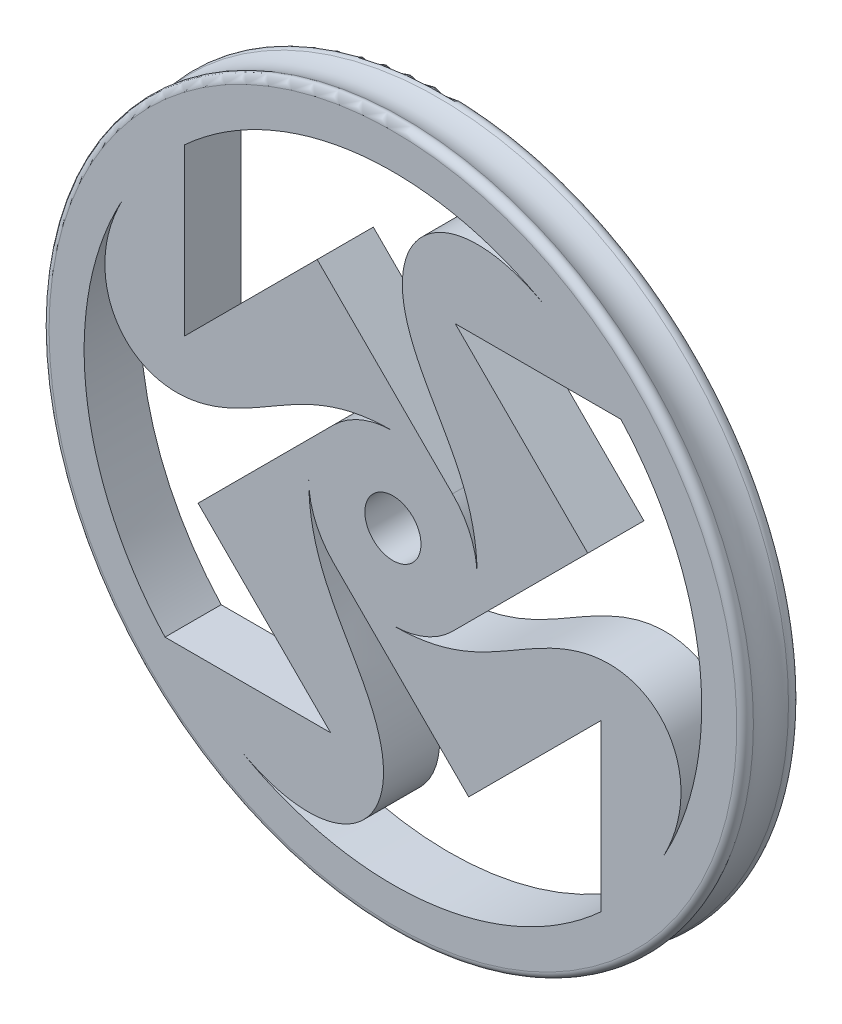
from build123d import *

# Parameters (mm, degrees)
CUT_EXTRUDE1_START = -6.35
CUT_EXTRUDE1_DEPTH = 6.35


# Read off the part's stored shape, not the designer's step: Cut-Extrude1
with BuildPart() as part:
    # Sketch1 → Revolve1 (revolve)
    with BuildSketch(Plane(origin=(0, 0, 0), x_dir=(0, 0, -1), z_dir=(1, 0, 0)), mode=Mode.PRIVATE) as revolve1_sk:
        with BuildLine():
            Line((-3.175, 3.175), (3.175, 3.175))
            Line((3.175, 3.175), (3.175, 38.896804014))
            ThreePointArc((3.175, 38.896804014), (2.778125, 39.584211679), (1.984375, 39.584211679))
            ThreePointArc((1.984375, 39.584211679), (0, 39.0525), (-1.984375, 39.584211679))
            ThreePointArc((-1.984375, 39.584211679), (-2.778125, 39.584211679), (-3.175, 38.896804014))
            Line((-3.175, 38.896804014), (-3.175, 3.175))
        make_face()
    revolve(revolve1_sk.sketch.rotate(Axis((0, 0, -3.4925), (0, 0, 1)), 90), axis=Axis((0, 0, -3.4925), (0, 0, 1)))

    # Cut-Extrude1 outline → Cut-Extrude1 (cut)
    with BuildSketch(Plane.XY.offset(3.175).offset(CUT_EXTRUDE1_START)):
        with BuildLine():
            ThreePointArc((6.735192091, 6.735192091), (8.799952547, 3.645059693), (9.525, 0))
            add(Edge.make_bspline(
                [(9.525, 0), (9.525, 16.300780004), (-3.753785862, 16.300780004), (-3.753785862, 32.585930164), (6.859779029, 36.483664171), (17.706636116, 30.103665266)],
                knots=[0, 0, 0, 0, 0, 0, 1, 1, 1, 1, 1, 1], degree=5))
            ThreePointArc((17.706636116, 30.103665266), (-3.638359508, 34.734967469), (-23.560358803, 25.781100017))
            Line((-23.560358803, 25.781100017), (-23.560358803, 7.047534491))
            Line((-23.560358803, 7.047534491), (-8.568754556, 22.039138738))
            Line((-8.568754556, 22.039138738), (6.735192091, 6.735192091))
        make_face()
        with BuildLine():
            ThreePointArc((-6.735192091, 6.735192091), (-3.645059693, 8.799952547), (0, 9.525))
            add(Edge.make_bspline(
                [(0, 9.525), (-16.300780004, 9.525), (-16.300780004, -3.753785862), (-32.585930164, -3.753785862), (-36.483664171, 6.859779029), (-30.103665266, 17.706636116)],
                knots=[0, 0, 0, 0, 0, 0, 1, 1, 1, 1, 1, 1], degree=5))
            ThreePointArc((-30.103665266, 17.706636116), (-34.734967469, -3.638359508), (-25.781100017, -23.560358803))
            Line((-25.781100017, -23.560358803), (-7.047534491, -23.560358803))
            Line((-7.047534491, -23.560358803), (-22.039138738, -8.568754556))
            Line((-22.039138738, -8.568754556), (-6.735192091, 6.735192091))
        make_face()
        with BuildLine():
            ThreePointArc((6.735192091, -6.735192091), (3.645059693, -8.799952547), (0, -9.525))
            add(Edge.make_bspline(
                [(0, -9.525), (16.300780004, -9.525), (16.300780004, 3.753785862), (32.585930164, 3.753785862), (36.483664171, -6.859779029), (30.103665266, -17.706636116)],
                knots=[0, 0, 0, 0, 0, 0, 1, 1, 1, 1, 1, 1], degree=5))
            ThreePointArc((30.103665266, -17.706636116), (34.734967469, 3.638359508), (25.781100017, 23.560358803))
            Line((25.781100017, 23.560358803), (7.047534491, 23.560358803))
            Line((7.047534491, 23.560358803), (22.039138738, 8.568754556))
            Line((22.039138738, 8.568754556), (6.735192091, -6.735192091))
        make_face()
        with BuildLine():
            ThreePointArc((-6.735192091, -6.735192091), (-8.799952547, -3.645059693), (-9.525, 0))
            add(Edge.make_bspline(
                [(-9.525, 0), (-9.525, -16.300780004), (3.753785862, -16.300780004), (3.753785862, -32.585930164), (-6.859779029, -36.483664171), (-17.706636116, -30.103665266)],
                knots=[0, 0, 0, 0, 0, 0, 1, 1, 1, 1, 1, 1], degree=5))
            ThreePointArc((-17.706636116, -30.103665266), (3.638359508, -34.734967469), (23.560358803, -25.781100017))
            Line((23.560358803, -25.781100017), (23.560358803, -7.047534491))
            Line((23.560358803, -7.047534491), (8.568754556, -22.039138738))
            Line((8.568754556, -22.039138738), (-6.735192091, -6.735192091))
        make_face()
    extrude(amount=CUT_EXTRUDE1_DEPTH, mode=Mode.SUBTRACT)


solid = part.part
